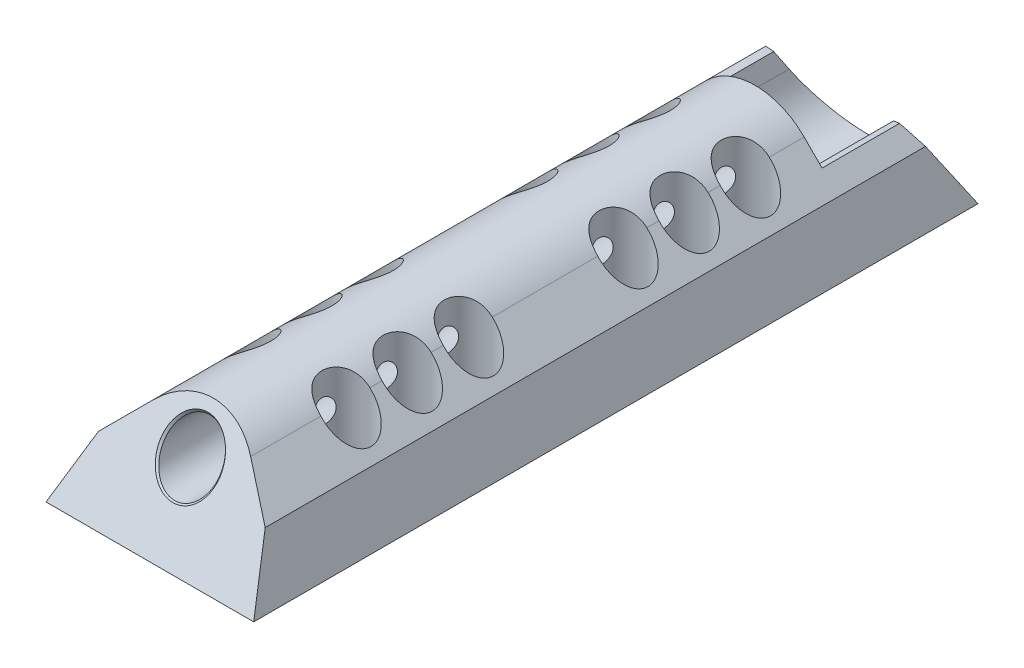
from build123d import *
from OCP.BRepAlgoAPI import BRepAlgoAPI_Cut
from OCP.TopTools import TopTools_ListOfShape

# Parameters (mm, degrees)
SKETCH_1_R               = 4.1
EXTRUDE_1_DEPTH          = 140
SKETCH_2_R               = 2.1
CUT_EXTRUDE_1_DEPTH      = 143.220386464
SKETCH_3_R               = 3.55
CUT_EXTRUDE_2_DEPTH      = 142.952367577
CUT_EXTRUDE_3_DEPTH      = 142.158846793
FILLET_1_R               = 10
PATTERN_LINEAR_1_COUNT   = 2
PATTERN_LINEAR_1_PITCH   = 40
CUT_EXTRUDE_5_DEPTH      = 133.057149837
CUT_EXTRUDE_5_DEPTH_BACK = 3
FILLET_3_R               = 0.5
CUT_EXTRUDE_7_DEPTH      = 142.155942252
CUT_EXTRUDE_7_DEPTH_BACK = 142.155942252
CUT_EXTRUDE_8_DEPTH      = 8
CUT_EXTRUDE_8_DEPTH_BACK = 10
CHAMFER_4_SIZE           = 1
FILLET_5_R               = 0.8
CHAMFER_5_SIZE           = 0.4


with BuildPart() as part:
    # Эскиз1 → Бобышка-Вытянуть1 (new body)
    with BuildSketch(Plane.XY):
        Polygon((0, 10.040916293), (12.040916293, -2), (15, -10), (-15, -10), (-12.040916293, -2), align=None)
        Circle(SKETCH_1_R, mode=Mode.SUBTRACT)
    extrude(amount=EXTRUDE_1_DEPTH)

    # Эскиз2 → Вырез-Вытянуть1 (cut, through all)
    with BuildSketch(Plane.XZ.offset(10)):
        with Locations(Location((-7.24, 70, 0), (0, 0, 270))):
            Circle(SKETCH_2_R)
        with Locations(Location((7.24, 70, 0), (0, 0, 270))):
            Circle(SKETCH_2_R)
        with Locations(Location((-7.24, 78.84, 0), (0, 0, 270))):
            Circle(SKETCH_2_R)
        with Locations(Location((7.24, 78.84, 0), (0, 0, 270))):
            Circle(SKETCH_2_R)
        with Locations(Location((-7.24, 61.16, 0), (0, 0, 270))):
            Circle(SKETCH_2_R)
        with Locations(Location((7.24, 61.16, 0), (0, 0, 270))):
            Circle(SKETCH_2_R)
    cut_extrude_1 = extrude(amount=-CUT_EXTRUDE_1_DEPTH, mode=Mode.SUBTRACT)

    # Эскиз3 → Вырез-Вытянуть2 (cut, through all)
    with BuildSketch(Plane(origin=(0, -8, 0), x_dir=(1, 0, 0), z_dir=(0, 1, 0))):
        with Locations(Location((-7.24, -61.16, 0), (0, 0, 180))):
            Circle(SKETCH_3_R)
        with Locations(Location((-7.24, -70, 0), (0, 0, 180))):
            Circle(SKETCH_3_R)
        with Locations(Location((-7.24, -78.84, 0), (0, 0, 180))):
            Circle(SKETCH_3_R)
        with Locations((7.24, -78.84)):
            Circle(SKETCH_3_R)
        with Locations((7.24, -70)):
            Circle(SKETCH_3_R)
        with Locations((7.24, -61.16)):
            Circle(SKETCH_3_R)
    cut_extrude_2 = extrude(amount=CUT_EXTRUDE_2_DEPTH, mode=Mode.SUBTRACT)

    # Эскиз4 → Вырез-Вытянуть3 (cut, symmetric)
    with BuildSketch(Plane(origin=(0, 0, 0), x_dir=(0, 0, -1), z_dir=(1, 0, 0))):
        Polygon((-140, -10), (-128.429371584, 10.040916293), (-140, 10.040916293), align=None)
    cut_extrude_3 = extrude(amount=CUT_EXTRUDE_3_DEPTH, both=True, mode=Mode.SUBTRACT)

    # Зеркальное отражение1: Вырез-Вытянуть3 across plane
    add(cut_extrude_3.mirror(Plane(origin=(0, 0, 70), x_dir=(1, 0, 0), z_dir=(0, 0, -1))), mode=Mode.SUBTRACT)

    # Скругление1
    # the kernel refuses this fillet: 10 mm, written as the material it takes off along each edge
    with BuildSketch(Plane(origin=(0, 10.040916293, -13.429371584), x_dir=(0.7071067811865476, -0.7071067811865476, 0), z_dir=(0, 0, 1))) as fillet_1_piece_1:
        with BuildLine():
            CenterArc((FILLET_1_R, -FILLET_1_R), FILLET_1_R, 90, 90)
            Line((0, -FILLET_1_R), (0, 0))
            Line((0, 0), (FILLET_1_R, 0))
        make_face()
    extrude(amount=166.858743167, mode=Mode.SUBTRACT)

    # Линейный массив1: Вырез-Вытянуть1, Вырез-Вытянуть2 ×2
    with Locations(*[(0, 0, i * PATTERN_LINEAR_1_PITCH) for i in range(1, PATTERN_LINEAR_1_COUNT)]):
        add(cut_extrude_1, mode=Mode.SUBTRACT)
        add(cut_extrude_2, mode=Mode.SUBTRACT)


with BuildPart() as chamfer_1_tool:
    # Фаска1: read off the stored shape, not the designer's step
    # Фаска1: loft between two sections, ruled curve by curve
    chamfer_1_from = [
        Edge.make_bspline([(0, -4.1, 3.573033255), (-0.134172233, -4.1, 3.573033255), (-0.268344118, -4.093408558, 3.577106771), (-0.535396433, -4.067106201, 3.593361645), (-0.668276169, -4.047395354, 3.605542962), (-0.931464472, -3.995043945, 3.637896167), (-1.061772355, -3.96240352, 3.658067973), (-1.318561999, -3.884507233, 3.70620793), (-1.445043093, -3.839251574, 3.734175958), (-1.692961053, -3.736560593, 3.797639054), (-1.814397275, -3.679125537, 3.833133958), (-2.051055967, -3.552628831, 3.911309007), (-2.166277821, -3.483567509, 3.953988951), (-2.38939809, -3.334483312, 4.046123086), (-2.497295926, -3.254460822, 4.095577038), (-2.704729004, -3.084224895, 4.200782956), (-2.804263707, -2.994011899, 4.256534649), (-2.994011899, -2.804263707, 4.37379916), (-3.084224895, -2.704729004, 4.435311673), (-3.254460822, -2.497295926, 4.563505455), (-3.334483312, -2.38939809, 4.630186391), (-3.483567509, -2.166277821, 4.768074868), (-3.552628831, -2.051055967, 4.839282052), (-3.679125537, -1.814397275, 4.985537283), (-3.736560593, -1.692961053, 5.060584951), (-3.839251574, -1.445043093, 5.213798418), (-3.884507233, -1.318561999, 5.291963819), (-3.96240352, -1.061772355, 5.450659992), (-3.995043945, -0.931464472, 5.531190352), (-4.047395354, -0.668276169, 5.693840901), (-4.067106201, -0.535396433, 5.775960668), (-4.093408558, -0.268344118, 5.940999179), (-4.1, -0.134172233, 6.023917494), (-4.1, 0.134172233, 6.189754556), (-4.093408558, 0.268344118, 6.272672872), (-4.067106201, 0.535396433, 6.437711382), (-4.047395354, 0.668276169, 6.519831149), (-3.995043945, 0.931464472, 6.682481698), (-3.96240352, 1.061772355, 6.763012058), (-3.884507233, 1.318561999, 6.921708231), (-3.839251574, 1.445043093, 6.999873633), (-3.736560593, 1.692961053, 7.1530871), (-3.679125537, 1.814397275, 7.228134767), (-3.552628831, 2.051055967, 7.374389998), (-3.483567509, 2.166277821, 7.445597182), (-3.334483312, 2.38939809, 7.583485659), (-3.254460822, 2.497295926, 7.650166595), (-3.084224895, 2.704729004, 7.778360377), (-2.994011899, 2.804263707, 7.839872891), (-2.804263707, 2.994011899, 7.957137402), (-2.704729004, 3.084224895, 8.012889094), (-2.497295926, 3.254460822, 8.118095013), (-2.38939809, 3.334483312, 8.167548965), (-2.166277821, 3.483567509, 8.2596831), (-2.051055967, 3.552628831, 8.302363043), (-1.814397275, 3.679125537, 8.380538093), (-1.692961053, 3.736560593, 8.416032996), (-1.445043093, 3.839251574, 8.479496092), (-1.318561999, 3.884507233, 8.50746412), (-1.061772355, 3.96240352, 8.555604078), (-0.931464472, 3.995043945, 8.575775883), (-0.668276169, 4.047395354, 8.608129089), (-0.535396433, 4.067106201, 8.620310405), (-0.268344118, 4.093408558, 8.63656528), (-0.134172233, 4.1, 8.640638796), (0.134172233, 4.1, 8.640638796), (0.268344118, 4.093408558, 8.63656528), (0.535396433, 4.067106201, 8.620310405), (0.668276169, 4.047395354, 8.608129089), (0.931464472, 3.995043945, 8.575775883), (1.061772355, 3.96240352, 8.555604078), (1.318561999, 3.884507233, 8.50746412), (1.445043093, 3.839251574, 8.479496092), (1.692961053, 3.736560593, 8.416032996), (1.814397275, 3.679125537, 8.380538093), (2.051055967, 3.552628831, 8.302363043), (2.166277821, 3.483567509, 8.2596831), (2.38939809, 3.334483312, 8.167548965), (2.497295926, 3.254460822, 8.118095013), (2.704729004, 3.084224895, 8.012889094), (2.804263707, 2.994011899, 7.957137402), (2.994011899, 2.804263707, 7.839872891), (3.084224895, 2.704729004, 7.778360377), (3.254460822, 2.497295926, 7.650166595), (3.334483312, 2.38939809, 7.583485659), (3.483567509, 2.166277821, 7.445597182), (3.552628831, 2.051055967, 7.374389998), (3.679125537, 1.814397275, 7.228134767), (3.736560593, 1.692961053, 7.1530871), (3.839251574, 1.445043093, 6.999873633), (3.884507233, 1.318561999, 6.921708231), (3.96240352, 1.061772355, 6.763012058), (3.995043945, 0.931464472, 6.682481698), (4.047395354, 0.668276169, 6.519831149), (4.067106201, 0.535396433, 6.437711382), (4.093408558, 0.268344118, 6.272672872), (4.1, 0.134172233, 6.189754556), (4.1, -0.134172233, 6.023917494), (4.093408558, -0.268344118, 5.940999179), (4.067106201, -0.535396433, 5.775960668), (4.047395354, -0.668276169, 5.693840901), (3.995043945, -0.931464472, 5.531190352), (3.96240352, -1.061772355, 5.450659992), (3.884507233, -1.318561999, 5.291963819), (3.839251574, -1.445043093, 5.213798418), (3.736560593, -1.692961053, 5.060584951), (3.679125537, -1.814397275, 4.985537283), (3.552628831, -2.051055967, 4.839282052), (3.483567509, -2.166277821, 4.768074868), (3.334483312, -2.38939809, 4.630186391), (3.254460822, -2.497295926, 4.563505455), (3.084224895, -2.704729004, 4.435311673), (2.994011899, -2.804263707, 4.37379916), (2.804263707, -2.994011899, 4.256534649), (2.704729004, -3.084224895, 4.200782956), (2.497295926, -3.254460822, 4.095577038), (2.38939809, -3.334483312, 4.046123086), (2.166277821, -3.483567509, 3.953988951), (2.051055967, -3.552628831, 3.911309007), (1.814397275, -3.679125537, 3.833133958), (1.692961053, -3.736560593, 3.797639054), (1.445043093, -3.839251574, 3.734175958), (1.318561999, -3.884507233, 3.70620793), (1.061772355, -3.96240352, 3.658067973), (0.931464472, -3.995043945, 3.637896167), (0.668276169, -4.047395354, 3.605542962), (0.535396433, -4.067106201, 3.593361645), (0.268344118, -4.093408558, 3.577106771), (0.134172233, -4.1, 3.573033255), (0, -4.1, 3.573033255)], [0, 0, 0, 0, 0.09817477, 0.09817477, 0.196349541, 0.196349541, 0.294524311, 0.294524311, 0.392699082, 0.392699082, 0.490873852, 0.490873852, 0.589048623, 0.589048623, 0.687223393, 0.687223393, 0.785398163, 0.785398163, 0.883572934, 0.883572934, 0.981747704, 0.981747704, 1.079922475, 1.079922475, 1.178097245, 1.178097245, 1.276272016, 1.276272016, 1.374446786, 1.374446786, 1.472621556, 1.472621556, 1.570796327, 1.570796327, 1.668971097, 1.668971097, 1.767145868, 1.767145868, 1.865320638, 1.865320638, 1.963495408, 1.963495408, 2.061670179, 2.061670179, 2.159844949, 2.159844949, 2.25801972, 2.25801972, 2.35619449, 2.35619449, 2.454369261, 2.454369261, 2.552544031, 2.552544031, 2.650718801, 2.650718801, 2.748893572, 2.748893572, 2.847068342, 2.847068342, 2.945243113, 2.945243113, 3.043417883, 3.043417883, 3.141592654, 3.141592654, 3.239767424, 3.239767424, 3.337942194, 3.337942194, 3.436116965, 3.436116965, 3.534291735, 3.534291735, 3.632466506, 3.632466506, 3.730641276, 3.730641276, 3.828816047, 3.828816047, 3.926990817, 3.926990817, 4.025165587, 4.025165587, 4.123340358, 4.123340358, 4.221515128, 4.221515128, 4.319689899, 4.319689899, 4.417864669, 4.417864669, 4.51603944, 4.51603944, 4.61421421, 4.61421421, 4.71238898, 4.71238898, 4.810563751, 4.810563751, 4.908738521, 4.908738521, 5.006913292, 5.006913292, 5.105088062, 5.105088062, 5.203262833, 5.203262833, 5.301437603, 5.301437603, 5.399612373, 5.399612373, 5.497787144, 5.497787144, 5.595961914, 5.595961914, 5.694136685, 5.694136685, 5.792311455, 5.792311455, 5.890486225, 5.890486225, 5.988660996, 5.988660996, 6.086835766, 6.086835766, 6.185010537, 6.185010537, 6.283185307, 6.283185307, 6.283185307, 6.283185307], 3),
    ]
    chamfer_1_to = [
        Edge.make_bspline([(0, -4.244337567, 3.323033255), (-0.143619108, -4.244337567, 3.323033255), (-0.287237844, -4.237282031, 3.327106771), (-0.573092929, -4.209127763, 3.343361645), (-0.715328538, -4.188029103, 3.355542962), (-0.997047553, -4.131991707, 3.387896167), (-1.136530227, -4.097053116, 3.408067973), (-1.411400063, -4.013672263, 3.45620793), (-1.54678651, -3.965230218, 3.484175958), (-1.812160019, -3.855308911, 3.547639054), (-1.942146392, -3.793829935, 3.583133958), (-2.195467883, -3.658426777, 3.661309007), (-2.318802343, -3.584502947, 3.703988951), (-2.557632191, -3.424921944, 3.796123086), (-2.67312696, -3.339265186, 3.845577038), (-2.895165104, -3.15704319, 3.950782956), (-3.001707903, -3.060478426, 4.006534649), (-3.204815993, -2.857370336, 4.12379916), (-3.301380758, -2.750827536, 4.185311673), (-3.483602753, -2.528789393, 4.313505455), (-3.569259511, -2.413294624, 4.380186391), (-3.728840514, -2.174464776, 4.518074868), (-3.802764345, -2.051130316, 4.589282052), (-3.938167502, -1.797808825, 4.735537283), (-3.999646478, -1.667822451, 4.810584951), (-4.109567785, -1.402448942, 4.963798418), (-4.15800983, -1.267062495, 5.041963819), (-4.241390683, -0.99219266, 5.200659992), (-4.276329274, -0.852709985, 5.281190352), (-4.332366671, -0.570990971, 5.443840901), (-4.35346533, -0.428755362, 5.525960668), (-4.381619599, -0.142900276, 5.690999179), (-4.388675135, 0.000718459, 5.773917494), (-4.388675135, 0.287956675, 5.939754556), (-4.381619599, 0.431575411, 6.022672872), (-4.35346533, 0.717430497, 6.187711382), (-4.332366671, 0.859666105, 6.269831149), (-4.276329274, 1.14138512, 6.432481698), (-4.241390683, 1.280867795, 6.513012058), (-4.15800983, 1.55573763, 6.671708231), (-4.109567785, 1.691124077, 6.749873633), (-3.999646478, 1.956497586, 6.9030871), (-3.938167502, 2.086483959, 6.978134767), (-3.802764345, 2.33980545, 7.124389998), (-3.728840514, 2.46313991, 7.195597182), (-3.569259511, 2.701969759, 7.333485659), (-3.483602753, 2.817464527, 7.400166595), (-3.301380758, 3.039502671, 7.528360377), (-3.204815993, 3.14604547, 7.589872891), (-3.001707903, 3.349153561, 7.707137402), (-2.895165104, 3.445718325, 7.762889094), (-2.67312696, 3.62794032, 7.868095013), (-2.557632191, 3.713597079, 7.917548965), (-2.318802343, 3.873178081, 8.0096831), (-2.195467883, 3.947101912, 8.052363043), (-1.942146392, 4.08250507, 8.130538093), (-1.812160019, 4.143984046, 8.166032996), (-1.54678651, 4.253905352, 8.229496092), (-1.411400063, 4.302347398, 8.25746412), (-1.136530227, 4.38572825, 8.305604078), (-0.997047553, 4.420666842, 8.325775883), (-0.715328538, 4.476704238, 8.358129089), (-0.573092929, 4.497802897, 8.370310405), (-0.287237844, 4.525957166, 8.38656528), (-0.143619108, 4.533012702, 8.390638796), (0.143619108, 4.533012702, 8.390638796), (0.287237844, 4.525957166, 8.38656528), (0.573092929, 4.497802897, 8.370310405), (0.715328538, 4.476704238, 8.358129089), (0.997047553, 4.420666842, 8.325775883), (1.136530227, 4.38572825, 8.305604078), (1.411400063, 4.302347398, 8.25746412), (1.54678651, 4.253905352, 8.229496092), (1.812160019, 4.143984046, 8.166032996), (1.942146392, 4.08250507, 8.130538093), (2.195467883, 3.947101912, 8.052363043), (2.318802343, 3.873178081, 8.0096831), (2.557632191, 3.713597079, 7.917548965), (2.67312696, 3.62794032, 7.868095013), (2.895165104, 3.445718325, 7.762889094), (3.001707903, 3.349153561, 7.707137402), (3.204815993, 3.14604547, 7.589872891), (3.301380758, 3.039502671, 7.528360377), (3.483602753, 2.817464527, 7.400166595), (3.569259511, 2.701969759, 7.333485659), (3.728840514, 2.46313991, 7.195597182), (3.802764345, 2.33980545, 7.124389998), (3.938167502, 2.086483959, 6.978134767), (3.999646478, 1.956497586, 6.9030871), (4.109567785, 1.691124077, 6.749873633), (4.15800983, 1.55573763, 6.671708231), (4.241390683, 1.280867795, 6.513012058), (4.276329274, 1.14138512, 6.432481698), (4.332366671, 0.859666105, 6.269831149), (4.35346533, 0.717430497, 6.187711382), (4.381619599, 0.431575411, 6.022672872), (4.388675135, 0.287956675, 5.939754556), (4.388675135, 0.000718459, 5.773917494), (4.381619599, -0.142900276, 5.690999179), (4.35346533, -0.428755362, 5.525960668), (4.332366671, -0.570990971, 5.443840901), (4.276329274, -0.852709985, 5.281190352), (4.241390683, -0.99219266, 5.200659992), (4.15800983, -1.267062495, 5.041963819), (4.109567785, -1.402448942, 4.963798418), (3.999646478, -1.667822451, 4.810584951), (3.938167502, -1.797808825, 4.735537283), (3.802764345, -2.051130316, 4.589282052), (3.728840514, -2.174464776, 4.518074868), (3.569259511, -2.413294624, 4.380186391), (3.483602753, -2.528789393, 4.313505455), (3.301380758, -2.750827536, 4.185311673), (3.204815993, -2.857370336, 4.12379916), (3.001707903, -3.060478426, 4.006534649), (2.895165104, -3.15704319, 3.950782956), (2.67312696, -3.339265186, 3.845577038), (2.557632191, -3.424921944, 3.796123086), (2.318802343, -3.584502947, 3.703988951), (2.195467883, -3.658426777, 3.661309007), (1.942146392, -3.793829935, 3.583133958), (1.812160019, -3.855308911, 3.547639054), (1.54678651, -3.965230218, 3.484175958), (1.411400063, -4.013672263, 3.45620793), (1.136530227, -4.097053116, 3.408067973), (0.997047553, -4.131991707, 3.387896167), (0.715328538, -4.188029103, 3.355542962), (0.573092929, -4.209127763, 3.343361645), (0.287237844, -4.237282031, 3.327106771), (0.143619108, -4.244337567, 3.323033255), (0, -4.244337567, 3.323033255)], [0, 0, 0, 0, 0.09817477, 0.09817477, 0.196349541, 0.196349541, 0.294524311, 0.294524311, 0.392699082, 0.392699082, 0.490873852, 0.490873852, 0.589048623, 0.589048623, 0.687223393, 0.687223393, 0.785398163, 0.785398163, 0.883572934, 0.883572934, 0.981747704, 0.981747704, 1.079922475, 1.079922475, 1.178097245, 1.178097245, 1.276272016, 1.276272016, 1.374446786, 1.374446786, 1.472621556, 1.472621556, 1.570796327, 1.570796327, 1.668971097, 1.668971097, 1.767145868, 1.767145868, 1.865320638, 1.865320638, 1.963495408, 1.963495408, 2.061670179, 2.061670179, 2.159844949, 2.159844949, 2.25801972, 2.25801972, 2.35619449, 2.35619449, 2.454369261, 2.454369261, 2.552544031, 2.552544031, 2.650718801, 2.650718801, 2.748893572, 2.748893572, 2.847068342, 2.847068342, 2.945243113, 2.945243113, 3.043417883, 3.043417883, 3.141592654, 3.141592654, 3.239767424, 3.239767424, 3.337942194, 3.337942194, 3.436116965, 3.436116965, 3.534291735, 3.534291735, 3.632466506, 3.632466506, 3.730641276, 3.730641276, 3.828816047, 3.828816047, 3.926990817, 3.926990817, 4.025165587, 4.025165587, 4.123340358, 4.123340358, 4.221515128, 4.221515128, 4.319689899, 4.319689899, 4.417864669, 4.417864669, 4.51603944, 4.51603944, 4.61421421, 4.61421421, 4.71238898, 4.71238898, 4.810563751, 4.810563751, 4.908738521, 4.908738521, 5.006913292, 5.006913292, 5.105088062, 5.105088062, 5.203262833, 5.203262833, 5.301437603, 5.301437603, 5.399612373, 5.399612373, 5.497787144, 5.497787144, 5.595961914, 5.595961914, 5.694136685, 5.694136685, 5.792311455, 5.792311455, 5.890486225, 5.890486225, 5.988660996, 5.988660996, 6.086835766, 6.086835766, 6.185010537, 6.185010537, 6.283185307, 6.283185307, 6.283185307, 6.283185307], 3),
    ]
    chamfer_1 = Solid(Shell([*[Face.make_surface_from_curves(chamfer_1_from[k], chamfer_1_to[k]) for k in range(1)], Face(Wire(chamfer_1_from)), Face(Wire(chamfer_1_to))]))
    add(chamfer_1)


with BuildPart() as part_1:
    add(part.part)

    # Фаска1: cut by chamfer_1_tool, with a tolerance
    chamfer_1_stock = TopTools_ListOfShape()
    chamfer_1_stock.Append(part_1.part.wrapped)
    chamfer_1_tools = TopTools_ListOfShape()
    chamfer_1_tools.Append(chamfer_1_tool.part.wrapped)
    chamfer_1_cut = BRepAlgoAPI_Cut()
    chamfer_1_cut.SetArguments(chamfer_1_stock)
    chamfer_1_cut.SetTools(chamfer_1_tools)
    chamfer_1_cut.SetFuzzyValue(0.00001)
    chamfer_1_cut.Build()
    add(Compound.cast(chamfer_1_cut.Shape()).solids(), mode=Mode.REPLACE)


with BuildPart() as chamfer_1_2_tool:
    # Chamfer 1 2: loft between two sections, ruled curve by curve
    chamfer_1_2_from = [
        Edge.make_bspline([(0, 4.533012702, 131.609361204), (0.143619108, 4.533012702, 131.609361204), (0.287237844, 4.525957166, 131.61343472), (0.573092929, 4.497802897, 131.629689595), (0.715328538, 4.476704238, 131.641870911), (0.997047553, 4.420666842, 131.674224117), (1.136530227, 4.38572825, 131.694395922), (1.411400063, 4.302347398, 131.74253588), (1.54678651, 4.253905352, 131.770503908), (1.812160019, 4.143984046, 131.833967004), (1.942146392, 4.08250507, 131.869461907), (2.195467883, 3.947101912, 131.947636957), (2.318802343, 3.873178081, 131.9903169), (2.557632191, 3.713597079, 132.082451035), (2.67312696, 3.62794032, 132.131904987), (2.895165104, 3.445718325, 132.237110906), (3.001707903, 3.349153561, 132.292862598), (3.204815993, 3.14604547, 132.410127109), (3.301380758, 3.039502671, 132.471639623), (3.483602753, 2.817464527, 132.599833405), (3.569259511, 2.701969759, 132.666514341), (3.728840514, 2.46313991, 132.804402818), (3.802764345, 2.33980545, 132.875610002), (3.938167502, 2.086483959, 133.021865233), (3.999646478, 1.956497586, 133.0969129), (4.109567785, 1.691124077, 133.250126367), (4.15800983, 1.55573763, 133.328291769), (4.241390683, 1.280867795, 133.486987942), (4.276329274, 1.14138512, 133.567518302), (4.332366671, 0.859666105, 133.730168851), (4.35346533, 0.717430497, 133.812288618), (4.381619599, 0.431575411, 133.977327128), (4.388675135, 0.287956675, 134.060245444), (4.388675135, 0.000718459, 134.226082506), (4.381619599, -0.142900276, 134.309000821), (4.35346533, -0.428755362, 134.474039332), (4.332366671, -0.570990971, 134.556159099), (4.276329274, -0.852709985, 134.718809648), (4.241390683, -0.99219266, 134.799340008), (4.15800983, -1.267062495, 134.958036181), (4.109567785, -1.402448942, 135.036201582), (3.999646478, -1.667822451, 135.189415049), (3.938167502, -1.797808825, 135.264462717), (3.802764345, -2.051130316, 135.410717948), (3.728840514, -2.174464776, 135.481925132), (3.569259511, -2.413294624, 135.619813609), (3.483602753, -2.528789393, 135.686494545), (3.301380758, -2.750827536, 135.814688327), (3.204815993, -2.857370336, 135.87620084), (3.001707903, -3.060478426, 135.993465351), (2.895165104, -3.15704319, 136.049217044), (2.67312696, -3.339265186, 136.154422962), (2.557632191, -3.424921944, 136.203876914), (2.318802343, -3.584502947, 136.296011049), (2.195467883, -3.658426777, 136.338690993), (1.942146392, -3.793829935, 136.416866042), (1.812160019, -3.855308911, 136.452360946), (1.54678651, -3.965230218, 136.515824042), (1.411400063, -4.013672263, 136.54379207), (1.136530227, -4.097053116, 136.591932027), (0.997047553, -4.131991707, 136.612103833), (0.715328538, -4.188029103, 136.644457038), (0.573092929, -4.209127763, 136.656638355), (0.287237844, -4.237282031, 136.672893229), (0.143619108, -4.244337567, 136.676966745), (-0.143619108, -4.244337567, 136.676966745), (-0.287237844, -4.237282031, 136.672893229), (-0.573092929, -4.209127763, 136.656638355), (-0.715328538, -4.188029103, 136.644457038), (-0.997047553, -4.131991707, 136.612103833), (-1.136530227, -4.097053116, 136.591932027), (-1.411400063, -4.013672263, 136.54379207), (-1.54678651, -3.965230218, 136.515824042), (-1.812160019, -3.855308911, 136.452360946), (-1.942146392, -3.793829935, 136.416866042), (-2.195467883, -3.658426777, 136.338690993), (-2.318802343, -3.584502947, 136.296011049), (-2.557632191, -3.424921944, 136.203876914), (-2.67312696, -3.339265186, 136.154422962), (-2.895165104, -3.15704319, 136.049217044), (-3.001707903, -3.060478426, 135.993465351), (-3.204815993, -2.857370336, 135.87620084), (-3.301380758, -2.750827536, 135.814688327), (-3.483602753, -2.528789393, 135.686494545), (-3.569259511, -2.413294624, 135.619813609), (-3.728840514, -2.174464776, 135.481925132), (-3.802764345, -2.051130316, 135.410717948), (-3.938167502, -1.797808825, 135.264462717), (-3.999646478, -1.667822451, 135.189415049), (-4.109567785, -1.402448942, 135.036201582), (-4.15800983, -1.267062495, 134.958036181), (-4.241390683, -0.99219266, 134.799340008), (-4.276329274, -0.852709985, 134.718809648), (-4.332366671, -0.570990971, 134.556159099), (-4.35346533, -0.428755362, 134.474039332), (-4.381619599, -0.142900276, 134.309000821), (-4.388675135, 0.000718459, 134.226082506), (-4.388675135, 0.287956675, 134.060245444), (-4.381619599, 0.431575411, 133.977327128), (-4.35346533, 0.717430497, 133.812288618), (-4.332366671, 0.859666105, 133.730168851), (-4.276329274, 1.14138512, 133.567518302), (-4.241390683, 1.280867795, 133.486987942), (-4.15800983, 1.55573763, 133.328291769), (-4.109567785, 1.691124077, 133.250126367), (-3.999646478, 1.956497586, 133.0969129), (-3.938167502, 2.086483959, 133.021865233), (-3.802764345, 2.33980545, 132.875610002), (-3.728840514, 2.46313991, 132.804402818), (-3.569259511, 2.701969759, 132.666514341), (-3.483602753, 2.817464527, 132.599833405), (-3.301380758, 3.039502671, 132.471639623), (-3.204815993, 3.14604547, 132.410127109), (-3.001707903, 3.349153561, 132.292862598), (-2.895165104, 3.445718325, 132.237110906), (-2.67312696, 3.62794032, 132.131904987), (-2.557632191, 3.713597079, 132.082451035), (-2.318802343, 3.873178081, 131.9903169), (-2.195467883, 3.947101912, 131.947636957), (-1.942146392, 4.08250507, 131.869461907), (-1.812160019, 4.143984046, 131.833967004), (-1.54678651, 4.253905352, 131.770503908), (-1.411400063, 4.302347398, 131.74253588), (-1.136530227, 4.38572825, 131.694395922), (-0.997047553, 4.420666842, 131.674224117), (-0.715328538, 4.476704238, 131.641870911), (-0.573092929, 4.497802897, 131.629689595), (-0.287237844, 4.525957166, 131.61343472), (-0.143619108, 4.533012702, 131.609361204), (0, 4.533012702, 131.609361204)], [0, 0, 0, 0, 0.09817477, 0.09817477, 0.196349541, 0.196349541, 0.294524311, 0.294524311, 0.392699082, 0.392699082, 0.490873852, 0.490873852, 0.589048623, 0.589048623, 0.687223393, 0.687223393, 0.785398163, 0.785398163, 0.883572934, 0.883572934, 0.981747704, 0.981747704, 1.079922475, 1.079922475, 1.178097245, 1.178097245, 1.276272016, 1.276272016, 1.374446786, 1.374446786, 1.472621556, 1.472621556, 1.570796327, 1.570796327, 1.668971097, 1.668971097, 1.767145868, 1.767145868, 1.865320638, 1.865320638, 1.963495408, 1.963495408, 2.061670179, 2.061670179, 2.159844949, 2.159844949, 2.25801972, 2.25801972, 2.35619449, 2.35619449, 2.454369261, 2.454369261, 2.552544031, 2.552544031, 2.650718801, 2.650718801, 2.748893572, 2.748893572, 2.847068342, 2.847068342, 2.945243113, 2.945243113, 3.043417883, 3.043417883, 3.141592654, 3.141592654, 3.239767424, 3.239767424, 3.337942194, 3.337942194, 3.436116965, 3.436116965, 3.534291735, 3.534291735, 3.632466506, 3.632466506, 3.730641276, 3.730641276, 3.828816047, 3.828816047, 3.926990817, 3.926990817, 4.025165587, 4.025165587, 4.123340358, 4.123340358, 4.221515128, 4.221515128, 4.319689899, 4.319689899, 4.417864669, 4.417864669, 4.51603944, 4.51603944, 4.61421421, 4.61421421, 4.71238898, 4.71238898, 4.810563751, 4.810563751, 4.908738521, 4.908738521, 5.006913292, 5.006913292, 5.105088062, 5.105088062, 5.203262833, 5.203262833, 5.301437603, 5.301437603, 5.399612373, 5.399612373, 5.497787144, 5.497787144, 5.595961914, 5.595961914, 5.694136685, 5.694136685, 5.792311455, 5.792311455, 5.890486225, 5.890486225, 5.988660996, 5.988660996, 6.086835766, 6.086835766, 6.185010537, 6.185010537, 6.283185307, 6.283185307, 6.283185307, 6.283185307], 3),
    ]
    chamfer_1_2_to = [
        Edge.make_bspline([(0, 4.1, 131.359361204), (0.134172233, 4.1, 131.359361204), (0.268344118, 4.093408558, 131.36343472), (0.535396433, 4.067106201, 131.379689595), (0.668276169, 4.047395354, 131.391870911), (0.931464472, 3.995043945, 131.424224117), (1.061772355, 3.96240352, 131.444395922), (1.318561999, 3.884507233, 131.49253588), (1.445043093, 3.839251574, 131.520503908), (1.692961053, 3.736560593, 131.583967004), (1.814397275, 3.679125537, 131.619461907), (2.051055967, 3.552628831, 131.697636957), (2.166277821, 3.483567509, 131.7403169), (2.38939809, 3.334483312, 131.832451035), (2.497295926, 3.254460822, 131.881904987), (2.704729004, 3.084224895, 131.987110906), (2.804263707, 2.994011899, 132.042862598), (2.994011899, 2.804263707, 132.160127109), (3.084224895, 2.704729004, 132.221639623), (3.254460822, 2.497295926, 132.349833405), (3.334483312, 2.38939809, 132.416514341), (3.483567509, 2.166277821, 132.554402818), (3.552628831, 2.051055967, 132.625610002), (3.679125537, 1.814397275, 132.771865233), (3.736560593, 1.692961053, 132.8469129), (3.839251574, 1.445043093, 133.000126367), (3.884507233, 1.318561999, 133.078291769), (3.96240352, 1.061772355, 133.236987942), (3.995043945, 0.931464472, 133.317518302), (4.047395354, 0.668276169, 133.480168851), (4.067106201, 0.535396433, 133.562288618), (4.093408558, 0.268344118, 133.727327128), (4.1, 0.134172233, 133.810245444), (4.1, -0.134172233, 133.976082506), (4.093408558, -0.268344118, 134.059000821), (4.067106201, -0.535396433, 134.224039332), (4.047395354, -0.668276169, 134.306159099), (3.995043945, -0.931464472, 134.468809648), (3.96240352, -1.061772355, 134.549340008), (3.884507233, -1.318561999, 134.708036181), (3.839251574, -1.445043093, 134.786201582), (3.736560593, -1.692961053, 134.939415049), (3.679125537, -1.814397275, 135.014462717), (3.552628831, -2.051055967, 135.160717948), (3.483567509, -2.166277821, 135.231925132), (3.334483312, -2.38939809, 135.369813609), (3.254460822, -2.497295926, 135.436494545), (3.084224895, -2.704729004, 135.564688327), (2.994011899, -2.804263707, 135.62620084), (2.804263707, -2.994011899, 135.743465351), (2.704729004, -3.084224895, 135.799217044), (2.497295926, -3.254460822, 135.904422962), (2.38939809, -3.334483312, 135.953876914), (2.166277821, -3.483567509, 136.046011049), (2.051055967, -3.552628831, 136.088690993), (1.814397275, -3.679125537, 136.166866042), (1.692961053, -3.736560593, 136.202360946), (1.445043093, -3.839251574, 136.265824042), (1.318561999, -3.884507233, 136.29379207), (1.061772355, -3.96240352, 136.341932027), (0.931464472, -3.995043945, 136.362103833), (0.668276169, -4.047395354, 136.394457038), (0.535396433, -4.067106201, 136.406638355), (0.268344118, -4.093408558, 136.422893229), (0.134172233, -4.1, 136.426966745), (-0.134172233, -4.1, 136.426966745), (-0.268344118, -4.093408558, 136.422893229), (-0.535396433, -4.067106201, 136.406638355), (-0.668276169, -4.047395354, 136.394457038), (-0.931464472, -3.995043945, 136.362103833), (-1.061772355, -3.96240352, 136.341932027), (-1.318561999, -3.884507233, 136.29379207), (-1.445043093, -3.839251574, 136.265824042), (-1.692961053, -3.736560593, 136.202360946), (-1.814397275, -3.679125537, 136.166866042), (-2.051055967, -3.552628831, 136.088690993), (-2.166277821, -3.483567509, 136.046011049), (-2.38939809, -3.334483312, 135.953876914), (-2.497295926, -3.254460822, 135.904422962), (-2.704729004, -3.084224895, 135.799217044), (-2.804263707, -2.994011899, 135.743465351), (-2.994011899, -2.804263707, 135.62620084), (-3.084224895, -2.704729004, 135.564688327), (-3.254460822, -2.497295926, 135.436494545), (-3.334483312, -2.38939809, 135.369813609), (-3.483567509, -2.166277821, 135.231925132), (-3.552628831, -2.051055967, 135.160717948), (-3.679125537, -1.814397275, 135.014462717), (-3.736560593, -1.692961053, 134.939415049), (-3.839251574, -1.445043093, 134.786201582), (-3.884507233, -1.318561999, 134.708036181), (-3.96240352, -1.061772355, 134.549340008), (-3.995043945, -0.931464472, 134.468809648), (-4.047395354, -0.668276169, 134.306159099), (-4.067106201, -0.535396433, 134.224039332), (-4.093408558, -0.268344118, 134.059000821), (-4.1, -0.134172233, 133.976082506), (-4.1, 0.134172233, 133.810245444), (-4.093408558, 0.268344118, 133.727327128), (-4.067106201, 0.535396433, 133.562288618), (-4.047395354, 0.668276169, 133.480168851), (-3.995043945, 0.931464472, 133.317518302), (-3.96240352, 1.061772355, 133.236987942), (-3.884507233, 1.318561999, 133.078291769), (-3.839251574, 1.445043093, 133.000126367), (-3.736560593, 1.692961053, 132.8469129), (-3.679125537, 1.814397275, 132.771865233), (-3.552628831, 2.051055967, 132.625610002), (-3.483567509, 2.166277821, 132.554402818), (-3.334483312, 2.38939809, 132.416514341), (-3.254460822, 2.497295926, 132.349833405), (-3.084224895, 2.704729004, 132.221639623), (-2.994011899, 2.804263707, 132.160127109), (-2.804263707, 2.994011899, 132.042862598), (-2.704729004, 3.084224895, 131.987110906), (-2.497295926, 3.254460822, 131.881904987), (-2.38939809, 3.334483312, 131.832451035), (-2.166277821, 3.483567509, 131.7403169), (-2.051055967, 3.552628831, 131.697636957), (-1.814397275, 3.679125537, 131.619461907), (-1.692961053, 3.736560593, 131.583967004), (-1.445043093, 3.839251574, 131.520503908), (-1.318561999, 3.884507233, 131.49253588), (-1.061772355, 3.96240352, 131.444395922), (-0.931464472, 3.995043945, 131.424224117), (-0.668276169, 4.047395354, 131.391870911), (-0.535396433, 4.067106201, 131.379689595), (-0.268344118, 4.093408558, 131.36343472), (-0.134172233, 4.1, 131.359361204), (0, 4.1, 131.359361204)], [0, 0, 0, 0, 0.09817477, 0.09817477, 0.196349541, 0.196349541, 0.294524311, 0.294524311, 0.392699082, 0.392699082, 0.490873852, 0.490873852, 0.589048623, 0.589048623, 0.687223393, 0.687223393, 0.785398163, 0.785398163, 0.883572934, 0.883572934, 0.981747704, 0.981747704, 1.079922475, 1.079922475, 1.178097245, 1.178097245, 1.276272016, 1.276272016, 1.374446786, 1.374446786, 1.472621556, 1.472621556, 1.570796327, 1.570796327, 1.668971097, 1.668971097, 1.767145868, 1.767145868, 1.865320638, 1.865320638, 1.963495408, 1.963495408, 2.061670179, 2.061670179, 2.159844949, 2.159844949, 2.25801972, 2.25801972, 2.35619449, 2.35619449, 2.454369261, 2.454369261, 2.552544031, 2.552544031, 2.650718801, 2.650718801, 2.748893572, 2.748893572, 2.847068342, 2.847068342, 2.945243113, 2.945243113, 3.043417883, 3.043417883, 3.141592654, 3.141592654, 3.239767424, 3.239767424, 3.337942194, 3.337942194, 3.436116965, 3.436116965, 3.534291735, 3.534291735, 3.632466506, 3.632466506, 3.730641276, 3.730641276, 3.828816047, 3.828816047, 3.926990817, 3.926990817, 4.025165587, 4.025165587, 4.123340358, 4.123340358, 4.221515128, 4.221515128, 4.319689899, 4.319689899, 4.417864669, 4.417864669, 4.51603944, 4.51603944, 4.61421421, 4.61421421, 4.71238898, 4.71238898, 4.810563751, 4.810563751, 4.908738521, 4.908738521, 5.006913292, 5.006913292, 5.105088062, 5.105088062, 5.203262833, 5.203262833, 5.301437603, 5.301437603, 5.399612373, 5.399612373, 5.497787144, 5.497787144, 5.595961914, 5.595961914, 5.694136685, 5.694136685, 5.792311455, 5.792311455, 5.890486225, 5.890486225, 5.988660996, 5.988660996, 6.086835766, 6.086835766, 6.185010537, 6.185010537, 6.283185307, 6.283185307, 6.283185307, 6.283185307], 3),
    ]
    chamfer_1_2 = Solid(Shell([*[Face.make_surface_from_curves(chamfer_1_2_from[k], chamfer_1_2_to[k]) for k in range(1)], Face(Wire(chamfer_1_2_from)), Face(Wire(chamfer_1_2_to))]))
    add(chamfer_1_2)


with BuildPart() as part_2:
    add(part_1.part)

    # Chamfer 1 2: cut by chamfer_1_2_tool, with a tolerance
    chamfer_1_2_stock = TopTools_ListOfShape()
    chamfer_1_2_stock.Append(part_2.part.wrapped)
    chamfer_1_2_tools = TopTools_ListOfShape()
    chamfer_1_2_tools.Append(chamfer_1_2_tool.part.wrapped)
    chamfer_1_2_cut = BRepAlgoAPI_Cut()
    chamfer_1_2_cut.SetArguments(chamfer_1_2_stock)
    chamfer_1_2_cut.SetTools(chamfer_1_2_tools)
    chamfer_1_2_cut.SetFuzzyValue(0.00001)
    chamfer_1_2_cut.Build()
    add(Compound.cast(chamfer_1_2_cut.Shape()).solids(), mode=Mode.REPLACE)

    # Эскиз6 → Вырез-Вытянуть5 (cut, two sides: drawn at the far end of the back side and taken through both)
    with BuildSketch(Plane(origin=(0, 0, 9.179165299), x_dir=(-1, 0, 0), z_dir=(0, 0, -1)).offset(-CUT_EXTRUDE_5_DEPTH_BACK)):
        with BuildLine():
            Line((-7.071067812, 2.969848481), (-8.955056089, 1.085860204))
            Line((-8.955056089, 1.085860204), (-7.891961617, -2.40404697))
            ThreePointArc((-7.891961617, -2.40404697), (0, -8.25), (7.891961617, -2.40404697))
            Line((7.891961617, -2.40404697), (8.955056089, 1.085860204))
            Line((8.955056089, 1.085860204), (7.071067812, 2.969848481))
            ThreePointArc((7.071067812, 2.969848481), (0, 5.898780669), (-7.071067812, 2.969848481))
        make_face()
    extrude(amount=CUT_EXTRUDE_5_DEPTH + CUT_EXTRUDE_5_DEPTH_BACK, mode=Mode.SUBTRACT)

    # Скругление3
    fillet_3_edges = [part_2.edges().sort_by_distance(p)[0] for p in [
        (8.423508853, -0.659093383, 12.179165299),
        (0, -8.25, 12.179165299),
        (-8.423508853, -0.659093383, 12.179165299),
    ]]
    fillet(fillet_3_edges, radius=FILLET_3_R)

    # Эскиз8 → Вырез-Вытянуть7 (cut, two sides: drawn at the far end of the back side and taken through both)
    with BuildSketch(Plane(origin=(0, 0, 0), x_dir=(0, 0, -1), z_dir=(1, 0, 0)).offset(-CUT_EXTRUDE_7_DEPTH_BACK)):
        Polygon((-35.4, -10), (-44.579165299, 5.898780669), (0, 5.898780669), (0, -10), align=None)
    extrude(amount=CUT_EXTRUDE_7_DEPTH + CUT_EXTRUDE_7_DEPTH_BACK, mode=Mode.SUBTRACT)

    # Эскиз9 → Вырез-Вытянуть8 (cut, two sides: drawn at the far end of the back side and taken through both)
    with BuildSketch(Plane.XY.offset(44.579165299).offset(-CUT_EXTRUDE_8_DEPTH_BACK)):
        with BuildLine():
            Line((7.071067812, 2.969848481), (8.955056089, 1.085860204))
            Line((8.955056089, 1.085860204), (7.891961617, -2.40404697))
            ThreePointArc((7.891961617, -2.40404697), (0, -8.25), (-7.891961617, -2.40404697))
            Line((-7.891961617, -2.40404697), (-8.955056089, 1.085860204))
            Line((-8.955056089, 1.085860204), (-7.071067812, 2.969848481))
            ThreePointArc((-7.071067812, 2.969848481), (0, 5.898780669), (7.071067812, 2.969848481))
        make_face()
    extrude(amount=CUT_EXTRUDE_8_DEPTH + CUT_EXTRUDE_8_DEPTH_BACK, mode=Mode.SUBTRACT)

    # Фаска4
    chamfer_4_edges = [part_2.edges().sort_by_distance(p)[0] for p in [
        (8.955056089, 1.085860204, 47.189794836),
        (-8.955056089, 1.085860204, 47.189794836),
    ]]
    chamfer(chamfer_4_edges, length=CHAMFER_4_SIZE)

    # Скругление5
    fillet_5_edges = [part_2.edges().sort_by_distance(p)[0] for p in [
        (0, -8.25, 52.579165299),
        (8.277809037, -1.137394087, 52.579165299),
        (-8.277809037, -1.137394087, 52.579165299),
    ]]
    fillet(fillet_5_edges, radius=FILLET_5_R)

    # Фаска5
    chamfer_5_edges = [part_2.edges().sort_by_distance(p)[0] for p in [
        (-4.1, 0, 52.579165299),
    ]]
    chamfer(chamfer_5_edges, length=CHAMFER_5_SIZE)


solid = part_2.part
